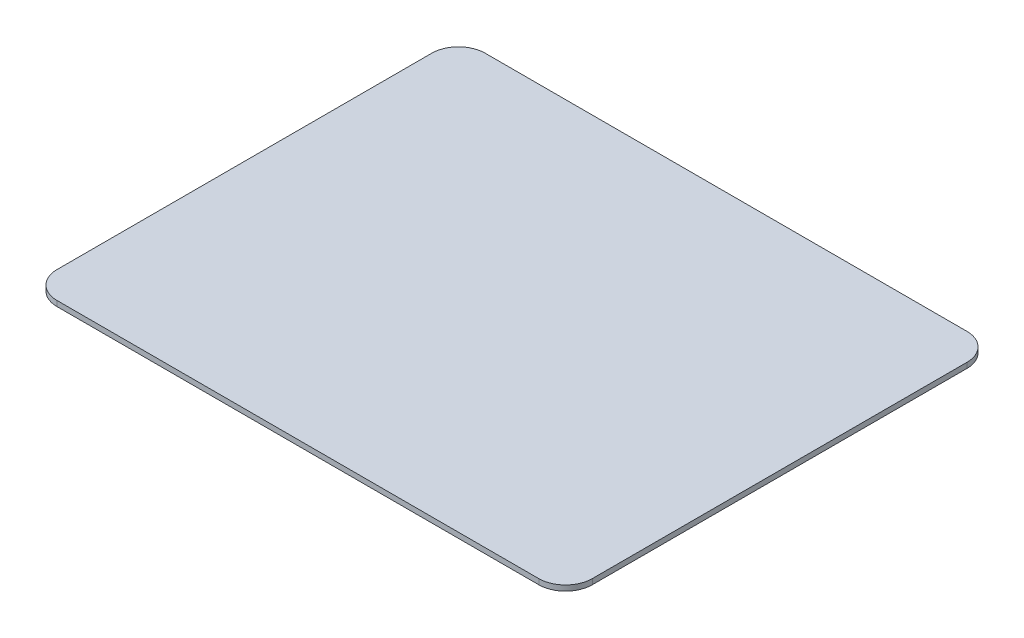
from build123d import *

# Parameters (mm, degrees)
BOSS_EXTRUDE1_DEPTH = 2.54


with BuildPart() as part:
    # Sketch1 → Boss-Extrude1 (new body)
    with BuildSketch(Plane(origin=(0, 0, 0), x_dir=(1, 0, 0), z_dir=(0, 1, 0))):
        with BuildLine():
            Line((-114.3, -101.6), (114.3, -101.6))
            ThreePointArc((114.3, -101.6), (123.280256121, -97.880256121), (127, -88.9))
            Line((127, -88.9), (127, 88.9))
            ThreePointArc((127, 88.9), (123.280256121, 97.880256121), (114.3, 101.6))
            Line((114.3, 101.6), (-114.3, 101.6))
            ThreePointArc((-114.3, 101.6), (-123.280256121, 97.880256121), (-127, 88.9))
            Line((-127, 88.9), (-127, -88.9))
            ThreePointArc((-127, -88.9), (-123.280256121, -97.880256121), (-114.3, -101.6))
        make_face()
    extrude(amount=BOSS_EXTRUDE1_DEPTH)


solid = part.part
